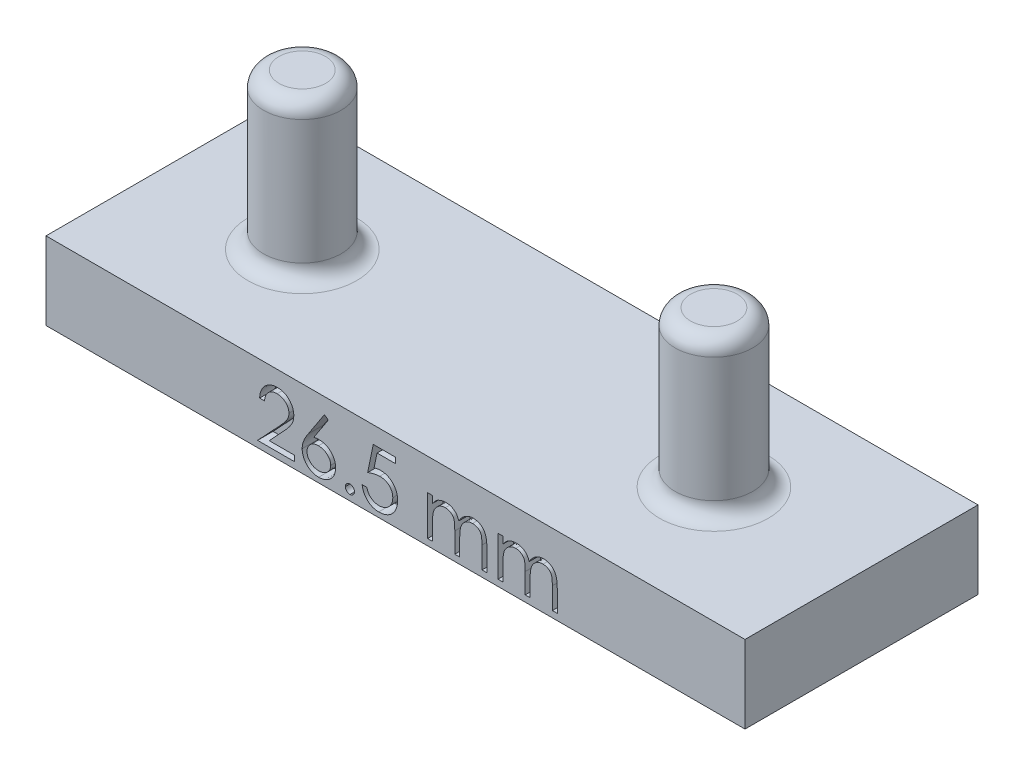
from build123d import *

# Parameters (mm, degrees)
SKETCH1_R             = 2.5
BOSS_EXTRUDE1_DEPTH   = 10
BOSS_EXTRUDE1_2_DEPTH = 10
SKETCH2_W             = 45
SKETCH2_H             = 15
BOSS_EXTRUDE2_DEPTH   = 5
CUT_EXTRUDE1_DEPTH    = 1
FILLET1_R             = 1


with BuildPart() as part:
    # Sketch1 → Boss-Extrude1 (new body)
    with BuildSketch(Plane(origin=(0, 0, 0), x_dir=(1, 0, 0), z_dir=(0, 1, 0))):
        with Locations((-41.821276596, 3.10212766)):
            Circle(SKETCH1_R)
    extrude(amount=BOSS_EXTRUDE1_DEPTH)



with BuildPart() as body_2:
    # Sketch1 → Boss-Extrude1 2 (new body)
    with BuildSketch(Plane(origin=(0, 0, 0), x_dir=(1, 0, 0), z_dir=(0, 1, 0))):
        with Locations((-15.321276596, 3.10212766)):
            Circle(SKETCH1_R)
    extrude(amount=BOSS_EXTRUDE1_2_DEPTH)


with BuildPart() as part_1:
    add(part.part)

    add(body_2.part)  # Boss-Extrude2 merges body 2
    # Sketch2 → Boss-Extrude2 (add)
    with BuildSketch(Plane.XZ):
        with Locations((-28.321276596, -3.10212766)):
            Rectangle(SKETCH2_W, SKETCH2_H)
    extrude(amount=BOSS_EXTRUDE2_DEPTH)

    # Sketch3 → Cut-Extrude1 (cut)
    # profile 1 of 6: a face of its own
    with BuildSketch(Plane.XY.offset(4.39787234)):
        with BuildLine():
            Line((-21.721415096, -2.034062219), (-21.407312532, -2.034062219))
            Line((-21.407312532, -2.034062219), (-21.407312532, -2.478573436))
            add(Edge.make_bspline(
                [(-21.407312532, -2.478573436), (-21.379028582, -2.439685835), (-21.324833822, -2.365173462), (-21.23596817, -2.266983177), (-21.147192057, -2.183655023), (-21.083258676, -2.139912151), (-21.052544904, -2.118897956)],
                knots=[0, 0, 0, 0, 1.134379233, 2.173579362, 3.122582517, 4, 4, 4, 4], degree=3))
            add(Edge.make_bspline(
                [(-21.052544904, -2.118897956), (-21.010680241, -2.09889259), (-20.927682342, -2.059231377), (-20.796263117, -2.018997818), (-20.661788447, -1.994272717), (-20.570980233, -1.990891343), (-20.525301314, -1.989190424)],
                knots=[0, 0, 0, 0, 1.014936303, 2.012140481, 3.000054389, 4, 4, 4, 4], degree=3))
            add(Edge.make_bspline(
                [(-20.525301314, -1.989190424), (-20.494408317, -1.990235714), (-20.433272738, -1.992304289), (-20.342688648, -2.005764324), (-20.254830036, -2.029030497), (-20.170216007, -2.061437821), (-20.090495328, -2.100684508), (-20.01740613, -2.146734216), (-19.951781922, -2.198431291), (-19.893655871, -2.258110224), (-19.841386845, -2.327446823), (-19.793307998, -2.408311072), (-19.748882786, -2.502518733), (-19.724261477, -2.570885274), (-19.71129891, -2.606878725)],
                knots=[0, 0, 0, 0, 1.009824226, 1.998387844, 2.986035974, 3.974953746, 4.955485308, 5.885931332, 6.793869504, 7.679848016, 8.601185859, 9.625726857, 10.749998409, 12, 12, 12, 12], degree=3))
            add(Edge.make_bspline(
                [(-19.71129891, -2.606878725), (-19.697587659, -2.582154306), (-19.670605842, -2.533500121), (-19.625300205, -2.464641858), (-19.577832408, -2.400235067), (-19.527797915, -2.340228642), (-19.475373328, -2.284918912), (-19.420311928, -2.23412301), (-19.362927146, -2.187622797), (-19.283134906, -2.133299637), (-19.179322299, -2.075598456), (-19.048434184, -2.025570012), (-18.912284013, -1.994653883), (-18.819866315, -1.99102361), (-18.773197949, -1.989190424)],
                knots=[0, 0, 0, 0, 0.86119277, 1.694706429, 2.50939023, 3.298075842, 4.073795165, 4.829715201, 5.57930267, 6.321991688, 7.768977793, 9.186738141, 10.579381044, 12, 12, 12, 12], degree=3))
            add(Edge.make_bspline(
                [(-18.773197949, -1.989190424), (-18.730316486, -1.990807645), (-18.646393299, -1.993972703), (-18.524216034, -2.018826176), (-18.410274228, -2.061503823), (-18.304797152, -2.11973746), (-18.209637339, -2.192916643), (-18.12692103, -2.279985481), (-18.057150666, -2.380328104), (-18.011572027, -2.474720092), (-17.980656762, -2.558055425), (-17.961595528, -2.629061717), (-17.944755833, -2.707213269), (-17.930774588, -2.792603531), (-17.920556036, -2.885534139), (-17.91298532, -2.985853015), (-17.907861247, -3.093638127), (-17.907499174, -3.168003627), (-17.907312532, -3.20633786)],
                knots=[0, 0, 0, 0, 1.209669288, 2.367440248, 3.500751976, 4.631527125, 5.755587489, 6.87532382, 8.007944318, 9.190864318, 9.82315674, 10.514484317, 11.263564316, 12.079023757, 12.955305781, 13.901327259, 14.918167583, 16, 16, 16, 16], degree=3))
            Line((-17.907312532, -3.20633786), (-17.907312532, -4.591754526))
            Line((-17.907312532, -4.591754526), (-18.221415096, -4.591754526))
            Line((-18.221415096, -4.591754526), (-18.221415096, -3.204935616))
            add(Edge.make_bspline(
                [(-18.221415096, -3.204935616), (-18.221492979, -3.172215042), (-18.221642658, -3.109331075), (-18.22433629, -3.019078624), (-18.229411604, -2.936810267), (-18.235346243, -2.862638179), (-18.243590052, -2.79638939), (-18.254235984, -2.738196972), (-18.265513664, -2.68760316), (-18.284249655, -2.631517113), (-18.314197546, -2.569646902), (-18.359815026, -2.502923326), (-18.417285133, -2.444842526), (-18.483645289, -2.394424209), (-18.559193734, -2.353430568), (-18.642458457, -2.324154558), (-18.732922509, -2.30603168), (-18.795545297, -2.304225665), (-18.827885449, -2.303292988)],
                knots=[0, 0, 0, 0, 1.253487763, 2.409012846, 3.458416907, 4.410876679, 5.259312806, 6.014470957, 6.676830364, 7.243083969, 8.276244668, 9.299465089, 10.325150304, 11.392391894, 12.482080715, 13.603491619, 14.762376348, 16, 16, 16, 16], degree=3))
            add(Edge.make_bspline(
                [(-18.827885449, -2.303292988), (-18.867555403, -2.304709145), (-18.945958314, -2.307508011), (-19.0604038, -2.336081884), (-19.170374817, -2.379162134), (-19.27258995, -2.441594591), (-19.36661774, -2.516402955), (-19.447517318, -2.605352551), (-19.514349504, -2.705982478), (-19.55960348, -2.79912918), (-19.588192781, -2.882798624), (-19.607069697, -2.955895996), (-19.621753088, -3.038977564), (-19.635523617, -3.131485055), (-19.644511345, -3.234055235), (-19.652679718, -3.346213636), (-19.656500581, -3.468297596), (-19.657035039, -3.552924284), (-19.657312532, -3.596862699)],
                knots=[0, 0, 0, 0, 1.090531906, 2.155305635, 3.229839962, 4.33261226, 5.44038871, 6.529323825, 7.629011124, 8.757537029, 9.370236727, 10.061839251, 10.834451254, 11.692844982, 12.636905849, 13.66920014, 14.789842145, 16, 16, 16, 16], degree=3))
            Line((-19.657312532, -3.596862699), (-19.657312532, -4.591754526))
            Line((-19.657312532, -4.591754526), (-19.971415096, -4.591754526))
            Line((-19.971415096, -4.591754526), (-19.971415096, -3.291173597))
            add(Edge.make_bspline(
                [(-19.971415096, -3.291173597), (-19.971494527, -3.254480278), (-19.971647344, -3.183886021), (-19.974323661, -3.082652345), (-19.979410283, -2.990571265), (-19.985290832, -2.907749802), (-19.99375101, -2.834338473), (-20.003360772, -2.769943715), (-20.014709383, -2.714726964), (-20.033499267, -2.654163579), (-20.062213736, -2.587442656), (-20.108401998, -2.516301635), (-20.166009578, -2.454033537), (-20.233580454, -2.400874789), (-20.309586136, -2.356933307), (-20.393569537, -2.325273556), (-20.48477445, -2.306849266), (-20.547652156, -2.304500769), (-20.579988814, -2.303292988)],
                knots=[0, 0, 0, 0, 1.320475261, 2.540461679, 3.643808994, 4.639130445, 5.527981419, 6.302341397, 6.981980563, 7.553956391, 8.582137848, 9.585246428, 10.591171744, 11.620968678, 12.668337649, 13.738356861, 14.836885341, 16, 16, 16, 16], degree=3))
            add(Edge.make_bspline(
                [(-20.579988814, -2.303292988), (-20.618005025, -2.304823448), (-20.693769985, -2.3078736), (-20.805071954, -2.335327874), (-20.912557638, -2.378331949), (-21.014512337, -2.437991768), (-21.108186485, -2.511890847), (-21.190194752, -2.598805742), (-21.259137278, -2.697654776), (-21.304869093, -2.789819292), (-21.334367567, -2.871392567), (-21.353962902, -2.940743515), (-21.370802527, -3.017743763), (-21.383316549, -3.102630874), (-21.395396965, -3.194851968), (-21.401227274, -3.294866458), (-21.406898836, -3.402588546), (-21.407171251, -3.476961091), (-21.407312532, -3.515532571)],
                knots=[0, 0, 0, 0, 1.098833095, 2.189935336, 3.297829714, 4.440610912, 5.596351641, 6.740013378, 7.886572111, 9.072425424, 9.705826452, 10.395263256, 11.156850408, 11.985370555, 12.878090359, 13.847760091, 14.883794034, 16, 16, 16, 16], degree=3))
            Line((-21.407312532, -3.515532571), (-21.407312532, -4.591754526))
            Line((-21.407312532, -4.591754526), (-21.721415096, -4.591754526))
            Line((-21.721415096, -4.591754526), (-21.721415096, -2.034062219))
        make_face()
    # profile 2 of 6: a face of its own
    with BuildSketch(Plane.XY.offset(4.39787234)):
        with BuildLine():
            Line((-26.253466378, -2.034062219), (-25.939363814, -2.034062219))
            Line((-25.939363814, -2.034062219), (-25.939363814, -2.478573436))
            add(Edge.make_bspline(
                [(-25.939363814, -2.478573436), (-25.911079864, -2.439685835), (-25.856885104, -2.365173462), (-25.768019452, -2.266983177), (-25.679243339, -2.183655023), (-25.615309958, -2.139912151), (-25.584596186, -2.118897956)],
                knots=[0, 0, 0, 0, 1.134379233, 2.173579362, 3.122582517, 4, 4, 4, 4], degree=3))
            add(Edge.make_bspline(
                [(-25.584596186, -2.118897956), (-25.542731524, -2.09889259), (-25.459733624, -2.059231377), (-25.328314399, -2.018997818), (-25.193839729, -1.994272717), (-25.103031515, -1.990891343), (-25.057352596, -1.989190424)],
                knots=[0, 0, 0, 0, 1.014936303, 2.012140481, 3.000054389, 4, 4, 4, 4], degree=3))
            add(Edge.make_bspline(
                [(-25.057352596, -1.989190424), (-25.026459599, -1.990235714), (-24.96532402, -1.992304289), (-24.87473993, -2.005764324), (-24.786881318, -2.029030497), (-24.702267289, -2.061437821), (-24.62254661, -2.100684508), (-24.549457412, -2.146734216), (-24.483833204, -2.198431291), (-24.425707153, -2.258110224), (-24.373438127, -2.327446823), (-24.325359281, -2.408311072), (-24.280934068, -2.502518733), (-24.256312759, -2.570885274), (-24.243350192, -2.606878725)],
                knots=[0, 0, 0, 0, 1.009824226, 1.998387844, 2.986035974, 3.974953746, 4.955485308, 5.885931332, 6.793869504, 7.679848016, 8.601185859, 9.625726857, 10.749998409, 12, 12, 12, 12], degree=3))
            add(Edge.make_bspline(
                [(-24.243350192, -2.606878725), (-24.229638941, -2.582154306), (-24.202657124, -2.533500121), (-24.157351487, -2.464641858), (-24.10988369, -2.400235067), (-24.059849197, -2.340228642), (-24.00742461, -2.284918912), (-23.95236321, -2.23412301), (-23.894978428, -2.187622797), (-23.815186189, -2.133299637), (-23.711373581, -2.075598456), (-23.580485466, -2.025570012), (-23.444335295, -1.994653883), (-23.351917597, -1.99102361), (-23.305249231, -1.989190424)],
                knots=[0, 0, 0, 0, 0.86119277, 1.694706429, 2.50939023, 3.298075842, 4.073795165, 4.829715201, 5.57930267, 6.321991688, 7.768977793, 9.186738141, 10.579381044, 12, 12, 12, 12], degree=3))
            add(Edge.make_bspline(
                [(-23.305249231, -1.989190424), (-23.262367768, -1.990807645), (-23.178444581, -1.993972703), (-23.056267316, -2.018826176), (-22.94232551, -2.061503823), (-22.836848434, -2.11973746), (-22.741688621, -2.192916643), (-22.658972312, -2.279985481), (-22.589201948, -2.380328104), (-22.543623309, -2.474720092), (-22.512708044, -2.558055425), (-22.49364681, -2.629061717), (-22.476807115, -2.707213269), (-22.46282587, -2.792603531), (-22.452607318, -2.885534139), (-22.445036602, -2.985853015), (-22.439912529, -3.093638127), (-22.439550456, -3.168003627), (-22.439363814, -3.20633786)],
                knots=[0, 0, 0, 0, 1.209669288, 2.367440248, 3.500751976, 4.631527125, 5.755587489, 6.87532382, 8.007944318, 9.190864318, 9.82315674, 10.514484317, 11.263564316, 12.079023757, 12.955305781, 13.901327259, 14.918167583, 16, 16, 16, 16], degree=3))
            Line((-22.439363814, -3.20633786), (-22.439363814, -4.591754526))
            Line((-22.439363814, -4.591754526), (-22.753466378, -4.591754526))
            Line((-22.753466378, -4.591754526), (-22.753466378, -3.204935616))
            add(Edge.make_bspline(
                [(-22.753466378, -3.204935616), (-22.753544261, -3.172215042), (-22.75369394, -3.109331075), (-22.756387572, -3.019078624), (-22.761462886, -2.936810267), (-22.767397525, -2.862638179), (-22.775641334, -2.79638939), (-22.786287266, -2.738196972), (-22.797564946, -2.68760316), (-22.816300937, -2.631517113), (-22.846248828, -2.569646902), (-22.891866308, -2.502923326), (-22.949336415, -2.444842526), (-23.015696571, -2.394424209), (-23.091245016, -2.353430568), (-23.174509739, -2.324154558), (-23.264973791, -2.30603168), (-23.327596579, -2.304225665), (-23.359936731, -2.303292988)],
                knots=[0, 0, 0, 0, 1.253487763, 2.409012846, 3.458416907, 4.410876679, 5.259312806, 6.014470957, 6.676830364, 7.243083969, 8.276244668, 9.299465089, 10.325150304, 11.392391894, 12.482080715, 13.603491619, 14.762376348, 16, 16, 16, 16], degree=3))
            add(Edge.make_bspline(
                [(-23.359936731, -2.303292988), (-23.399606685, -2.304709145), (-23.478009596, -2.307508011), (-23.592455082, -2.336081884), (-23.702426099, -2.379162134), (-23.804641232, -2.441594591), (-23.898669022, -2.516402955), (-23.9795686, -2.605352551), (-24.046400786, -2.705982478), (-24.091654762, -2.79912918), (-24.120244063, -2.882798624), (-24.139120979, -2.955895996), (-24.15380437, -3.038977564), (-24.1675749, -3.131485055), (-24.176562628, -3.234055235), (-24.184731, -3.346213636), (-24.188551863, -3.468297596), (-24.189086321, -3.552924284), (-24.189363814, -3.596862699)],
                knots=[0, 0, 0, 0, 1.090531906, 2.155305635, 3.229839962, 4.33261226, 5.44038871, 6.529323825, 7.629011124, 8.757537029, 9.370236727, 10.061839251, 10.834451254, 11.692844982, 12.636905849, 13.66920014, 14.789842145, 16, 16, 16, 16], degree=3))
            Line((-24.189363814, -3.596862699), (-24.189363814, -4.591754526))
            Line((-24.189363814, -4.591754526), (-24.503466378, -4.591754526))
            Line((-24.503466378, -4.591754526), (-24.503466378, -3.291173597))
            add(Edge.make_bspline(
                [(-24.503466378, -3.291173597), (-24.503545809, -3.254480278), (-24.503698626, -3.183886021), (-24.506374944, -3.082652345), (-24.511461565, -2.990571265), (-24.517342114, -2.907749802), (-24.525802292, -2.834338473), (-24.535412054, -2.769943715), (-24.546760665, -2.714726964), (-24.565550549, -2.654163579), (-24.594265018, -2.587442656), (-24.64045328, -2.516301635), (-24.69806086, -2.454033537), (-24.765631736, -2.400874789), (-24.841637418, -2.356933307), (-24.925620819, -2.325273556), (-25.016825732, -2.306849266), (-25.079703438, -2.304500769), (-25.112040096, -2.303292988)],
                knots=[0, 0, 0, 0, 1.320475261, 2.540461679, 3.643808994, 4.639130445, 5.527981419, 6.302341397, 6.981980563, 7.553956391, 8.582137848, 9.585246428, 10.591171744, 11.620968678, 12.668337649, 13.738356861, 14.836885341, 16, 16, 16, 16], degree=3))
            add(Edge.make_bspline(
                [(-25.112040096, -2.303292988), (-25.150056307, -2.304823448), (-25.225821267, -2.3078736), (-25.337123236, -2.335327874), (-25.44460892, -2.378331949), (-25.546563619, -2.437991768), (-25.640237767, -2.511890847), (-25.722246034, -2.598805742), (-25.79118856, -2.697654776), (-25.836920375, -2.789819292), (-25.866418849, -2.871392567), (-25.886014184, -2.940743515), (-25.90285381, -3.017743763), (-25.915367831, -3.102630874), (-25.927448247, -3.194851968), (-25.933278556, -3.294866458), (-25.938950118, -3.402588546), (-25.939222533, -3.476961091), (-25.939363814, -3.515532571)],
                knots=[0, 0, 0, 0, 1.098833095, 2.189935336, 3.297829714, 4.440610912, 5.596351641, 6.740013378, 7.886572111, 9.072425424, 9.705826452, 10.395263256, 11.156850408, 11.985370555, 12.878090359, 13.847760091, 14.883794034, 16, 16, 16, 16], degree=3))
            Line((-25.939363814, -3.515532571), (-25.939363814, -4.591754526))
            Line((-25.939363814, -4.591754526), (-26.253466378, -4.591754526))
            Line((-26.253466378, -4.591754526), (-26.253466378, -2.034062219))
        make_face()
    # profile 3 of 6: a face of its own
    with BuildSketch(Plane.XY.offset(4.39787234)):
        with BuildLine():
            Line((-28.317568942, -1.091754526), (-28.317568942, -1.450728885))
            Line((-28.317568942, -1.450728885), (-29.50807375, -1.450728885))
            Line((-29.50807375, -1.450728885), (-29.696675513, -2.371301802))
            add(Edge.make_bspline(
                [(-29.696675513, -2.371301802), (-29.659619638, -2.36107153), (-29.587829742, -2.341251996), (-29.481869881, -2.319246226), (-29.381277678, -2.305980782), (-29.316002308, -2.304169471), (-29.284415897, -2.303292988)],
                knots=[0, 0, 0, 0, 1.100273476, 2.13160584, 3.095893838, 4, 4, 4, 4], degree=3))
            add(Edge.make_bspline(
                [(-29.284415897, -2.303292988), (-29.245332158, -2.304138923), (-29.16848376, -2.305802244), (-29.056044813, -2.321774094), (-28.94871192, -2.346914008), (-28.84670955, -2.38203453), (-28.749848999, -2.426944263), (-28.659021438, -2.483044204), (-28.572863525, -2.548577535), (-28.492920931, -2.623922547), (-28.420396623, -2.706844164), (-28.356630633, -2.796002035), (-28.302468043, -2.890529697), (-28.258907288, -2.991330306), (-28.224122953, -3.097289459), (-28.200970959, -3.209522042), (-28.18555425, -3.326970162), (-28.183831863, -3.407274732), (-28.182953557, -3.448224879)],
                knots=[0, 0, 0, 0, 1.052922333, 2.070308379, 3.05430497, 4.020497103, 4.973039431, 5.925935799, 6.892292201, 7.88610001, 8.88166317, 9.857072816, 10.836096531, 11.812156883, 12.81219415, 13.836441305, 14.89672472, 16, 16, 16, 16], degree=3))
            add(Edge.make_bspline(
                [(-28.182953557, -3.448224879), (-28.183618633, -3.476747099), (-28.184939795, -3.533406087), (-28.191658383, -3.617550287), (-28.204594099, -3.69991312), (-28.221961823, -3.780505512), (-28.244504241, -3.859174885), (-28.271793295, -3.936146412), (-28.305189323, -4.010941019), (-28.341820698, -4.084266414), (-28.383067176, -4.154464921), (-28.428845683, -4.220113908), (-28.477211174, -4.282198189), (-28.52925256, -4.340051922), (-28.585453555, -4.39329494), (-28.645133522, -4.442243222), (-28.707816241, -4.487724552), (-28.774471483, -4.527892747), (-28.843613966, -4.564855703), (-28.916242183, -4.595179241), (-28.990702884, -4.622289769), (-29.068067759, -4.643899296), (-29.148161572, -4.660831851), (-29.231116347, -4.672332452), (-29.316497018, -4.680708889), (-29.37437203, -4.681233246), (-29.403606602, -4.681498116)],
                knots=[0, 0, 0, 0, 1.056347294, 2.098418968, 3.122841568, 4.141288669, 5.149314143, 6.15115421, 7.162517403, 8.180376062, 9.185164535, 10.17417709, 11.141909838, 12.097768115, 13.052685741, 14.0056014, 14.954263652, 15.917497458, 16.885230207, 17.854509472, 18.828990115, 19.81800267, 20.826176721, 21.857883937, 22.917946725, 24, 24, 24, 24], degree=3))
            add(Edge.make_bspline(
                [(-29.403606602, -4.681498116), (-29.438480783, -4.680807278), (-29.507091614, -4.679448136), (-29.607612181, -4.665229651), (-29.704326787, -4.644865734), (-29.796456888, -4.614229464), (-29.884828151, -4.57584217), (-29.968250869, -4.527325998), (-30.048856645, -4.472346894), (-30.123368682, -4.407466541), (-30.192524795, -4.336550859), (-30.254431304, -4.259593218), (-30.309564881, -4.177863776), (-30.357042628, -4.090965622), (-30.397540649, -3.999127091), (-30.429355638, -3.90200409), (-30.455033993, -3.800104086), (-30.465897413, -3.729950576), (-30.471415096, -3.694318629)],
                knots=[0, 0, 0, 0, 1.0467383, 2.05933395, 3.04377827, 4.011590433, 4.970194871, 5.932262533, 6.905835911, 7.896367577, 8.894135286, 9.877477877, 10.858688626, 11.851381753, 12.8477658, 13.868841284, 14.917554742, 16, 16, 16, 16], degree=3))
            Line((-30.471415096, -3.694318629), (-30.157312532, -3.694318629))
            add(Edge.make_bspline(
                [(-30.157312532, -3.694318629), (-30.149583974, -3.727695081), (-30.134729258, -3.791846476), (-30.102123509, -3.881977817), (-30.062257634, -3.962297041), (-30.014853285, -4.033866624), (-29.958303255, -4.096275622), (-29.893773826, -4.151892684), (-29.821426103, -4.202067813), (-29.741032873, -4.24389058), (-29.656219794, -4.279559334), (-29.567452584, -4.303311028), (-29.477148237, -4.320011921), (-29.416069867, -4.321683682), (-29.385377436, -4.322523757)],
                knots=[0, 0, 0, 0, 1.136247022, 2.183929868, 3.172523383, 4.106158343, 5.02341133, 5.958108904, 6.928429099, 7.938127109, 8.96079061, 9.975095812, 10.982467395, 12, 12, 12, 12], degree=3))
            add(Edge.make_bspline(
                [(-29.385377436, -4.322523757), (-29.355418991, -4.321702979), (-29.296430569, -4.320086861), (-29.209619182, -4.307647849), (-29.125806308, -4.288490277), (-29.045818951, -4.259820422), (-28.968257412, -4.224975704), (-28.895083641, -4.180260628), (-28.824180764, -4.12880061), (-28.757752631, -4.06984398), (-28.696913182, -4.004874285), (-28.64315706, -3.935396892), (-28.598380147, -3.861280045), (-28.560646038, -3.783806892), (-28.531992739, -3.702128335), (-28.511551758, -3.61662716), (-28.499548699, -3.52709218), (-28.497897519, -3.46602287), (-28.497056122, -3.434903565)],
                knots=[0, 0, 0, 0, 1.027316725, 2.022795036, 3.002884548, 3.971462791, 4.93288096, 5.914575861, 6.907176829, 7.935150275, 8.956128384, 9.956726525, 10.942570165, 11.921478529, 12.907843606, 13.90538589, 14.932640048, 16, 16, 16, 16], degree=3))
            add(Edge.make_bspline(
                [(-28.497056122, -3.434903565), (-28.497714601, -3.406827813), (-28.499003481, -3.351873524), (-28.509534051, -3.271474318), (-28.527851024, -3.195401275), (-28.553274904, -3.123287041), (-28.585554411, -3.055063599), (-28.625000724, -2.990660539), (-28.672354122, -2.930926706), (-28.72644601, -2.875834152), (-28.785704051, -2.824989277), (-28.851147794, -2.781645191), (-28.92140772, -2.745181273), (-28.99563732, -2.713713275), (-29.075602218, -2.691112529), (-29.159718851, -2.674144644), (-29.248895559, -2.664329281), (-29.309866247, -2.662967393), (-29.341206763, -2.662267347)],
                knots=[0, 0, 0, 0, 1.045622112, 2.046656509, 3.013763289, 3.955457236, 4.890082067, 5.820317437, 6.762574623, 7.722996705, 8.69280354, 9.665887285, 10.63943826, 11.638615906, 12.663482002, 13.728887084, 14.832589034, 16, 16, 16, 16], degree=3))
            add(Edge.make_bspline(
                [(-29.341206763, -2.662267347), (-29.368335691, -2.662847938), (-29.424350047, -2.664046711), (-29.510272873, -2.672873208), (-29.600564596, -2.687112503), (-29.694879092, -2.70669875), (-29.7934996, -2.732329827), (-29.896218001, -2.763044327), (-30.003250267, -2.799766326), (-30.075367992, -2.82749854), (-30.112440737, -2.841754526)],
                knots=[0, 0, 0, 0, 0.817624296, 1.688186739, 2.600797293, 3.572016777, 4.590301741, 5.671205678, 6.80286297, 8, 8, 8, 8], degree=3))
            Line((-30.112440737, -2.841754526), (-29.753466378, -1.091754526))
            Line((-29.753466378, -1.091754526), (-28.317568942, -1.091754526))
        make_face()
    # profile 4 of 6: a face of its own
    with BuildSketch(Plane.XY.offset(4.39787234)):
        with BuildLine():
            add(Edge.make_bspline(
                [(-31.256671506, -4.053292988), (-31.237181294, -4.054451154), (-31.198973012, -4.056721605), (-31.143733883, -4.072298279), (-31.093739224, -4.099956939), (-31.049206979, -4.136819717), (-31.012500502, -4.181515381), (-30.98385615, -4.231111289), (-30.968415165, -4.286812882), (-30.966161253, -4.325242557), (-30.96500484, -4.344959654)],
                knots=[0, 0, 0, 0, 1.020151414, 1.999887582, 2.974338812, 3.990962822, 5.007586832, 5.987933904, 6.967670073, 8, 8, 8, 8], degree=3))
            add(Edge.make_bspline(
                [(-30.96500484, -4.344959654), (-30.96620044, -4.364202984), (-30.968558147, -4.402150548), (-30.983820756, -4.457432011), (-31.012718806, -4.507058915), (-31.048953799, -4.552361053), (-31.093750232, -4.589301924), (-31.143852079, -4.616725268), (-31.198843337, -4.633417248), (-31.23715966, -4.635543545), (-31.256671506, -4.636626321)],
                knots=[0, 0, 0, 0, 1.009421747, 1.99056486, 2.972319754, 3.999869655, 5.017953583, 5.993804169, 6.978383603, 8, 8, 8, 8], degree=3))
            add(Edge.make_bspline(
                [(-31.256671506, -4.636626321), (-31.276197412, -4.635582724), (-31.314317094, -4.633545349), (-31.369103089, -4.616382543), (-31.419510057, -4.589559082), (-31.464297769, -4.552292173), (-31.500836241, -4.507292029), (-31.528461623, -4.457090233), (-31.545051772, -4.402308796), (-31.547233645, -4.364234153), (-31.548338173, -4.344959654)],
                knots=[0, 0, 0, 0, 1.022052826, 1.995314843, 2.982371812, 4.00089066, 5.028879526, 6.005146991, 6.990147033, 8, 8, 8, 8], degree=3))
            add(Edge.make_bspline(
                [(-31.548338173, -4.344959654), (-31.547276074, -4.325210275), (-31.545202455, -4.286652035), (-31.528426795, -4.231452927), (-31.501050583, -4.181284488), (-31.464045188, -4.136887908), (-31.419520892, -4.099700605), (-31.369224687, -4.072635812), (-31.314185147, -4.0565954), (-31.276175208, -4.054412883), (-31.256671506, -4.053292988)],
                knots=[0, 0, 0, 0, 1.032775665, 2.016367738, 2.991239715, 4.008302682, 5.025365648, 6.011011707, 6.979408107, 8, 8, 8, 8], degree=3))
        make_face()
    # profile 5 of 6: a face of its own
    with BuildSketch(Plane.XY.offset(4.39787234)):
        with BuildLine():
            Line((-32.894492019, -1.002010936), (-32.652605, -1.192014943))
            Line((-32.652605, -1.192014943), (-33.577384647, -2.606177603))
            add(Edge.make_bspline(
                [(-33.577384647, -2.606177603), (-33.51581437, -2.596363743), (-33.395714583, -2.577220698), (-33.274148685, -2.574062752), (-33.214904679, -2.572523757)],
                knots=[0, 0, 0, 0, 1.025318673, 2, 2, 2, 2], degree=3))
            add(Edge.make_bspline(
                [(-33.214904679, -2.572523757), (-33.179332183, -2.573479869), (-33.109308782, -2.575361946), (-33.00650198, -2.589845797), (-32.907713044, -2.612670909), (-32.813351432, -2.645943165), (-32.72307845, -2.688445519), (-32.636376054, -2.739384389), (-32.554874044, -2.80139007), (-32.477522865, -2.870655025), (-32.407295767, -2.94737201), (-32.345119712, -3.028773347), (-32.29289292, -3.114774228), (-32.250518999, -3.205331094), (-32.21761412, -3.300304353), (-32.193626475, -3.399572493), (-32.179446882, -3.503203964), (-32.177521391, -3.573682139), (-32.176543301, -3.609482892)],
                knots=[0, 0, 0, 0, 1.04369286, 2.054478336, 3.041073146, 4.015093852, 4.984733326, 5.965804835, 6.960378782, 7.985147595, 9.009457201, 10.008161701, 10.986880575, 11.956520048, 12.937015923, 13.931873656, 14.949455224, 16, 16, 16, 16], degree=3))
            add(Edge.make_bspline(
                [(-32.176543301, -3.609482892), (-32.177966406, -3.658462596), (-32.18076674, -3.754843062), (-32.208670536, -3.895219768), (-32.25203018, -4.028952283), (-32.314007709, -4.153905455), (-32.390990092, -4.269908024), (-32.484867684, -4.37269349), (-32.592311173, -4.464363527), (-32.713797971, -4.541020146), (-32.844540935, -4.603623197), (-32.981892932, -4.648588439), (-33.124520079, -4.676271909), (-33.221324687, -4.679742512), (-33.270293301, -4.681498116)],
                knots=[0, 0, 0, 0, 1.031375318, 2.029502543, 3.004789286, 3.987476834, 4.960371455, 5.9300674, 6.912260825, 7.929083631, 8.949397511, 9.960523116, 10.96833055, 12, 12, 12, 12], degree=3))
            add(Edge.make_bspline(
                [(-33.270293301, -4.681498116), (-33.317390002, -4.67996991), (-33.41068032, -4.676942802), (-33.547913114, -4.649976864), (-33.679776131, -4.606269762), (-33.805345512, -4.546055483), (-33.921666125, -4.4699976), (-34.025731762, -4.378435321), (-34.117023536, -4.273325856), (-34.192998157, -4.154685509), (-34.253256889, -4.027195551), (-34.298446814, -3.894258395), (-34.324843057, -3.756358413), (-34.328531614, -3.662877274), (-34.330389455, -3.615792988)],
                knots=[0, 0, 0, 0, 1.012016664, 2.004627821, 2.994792927, 3.992885782, 4.990978636, 5.973936114, 6.964471063, 7.975201453, 8.993600317, 9.990122807, 10.98767138, 12, 12, 12, 12], degree=3))
            add(Edge.make_bspline(
                [(-34.330389455, -3.615792988), (-34.32920801, -3.579748405), (-34.326795725, -3.506152253), (-34.309952335, -3.394688225), (-34.28288754, -3.280637143), (-34.252577293, -3.183882949), (-34.220551683, -3.104621427), (-34.193899144, -3.040717937), (-34.160725148, -2.974956863), (-34.125351767, -2.905083228), (-34.084594898, -2.832897795), (-34.040279248, -2.757194125), (-33.991179597, -2.679176198), (-33.956759435, -2.626232002), (-33.939163493, -2.599166385)],
                knots=[0, 0, 0, 0, 1.173818275, 2.396712641, 3.66331629, 4.989737886, 5.693666774, 6.447286557, 7.243889047, 8.091586357, 8.998013824, 9.943181721, 10.948533338, 12, 12, 12, 12], degree=3))
            Line((-33.939163493, -2.599166385), (-32.894492019, -1.002010936))
        make_face()
        with BuildLine():
            add(Edge.make_bspline(
                [(-33.280810128, -2.931498116), (-33.307472373, -2.93227616), (-33.359551482, -2.933795905), (-33.435958897, -2.942621157), (-33.508272148, -2.959240222), (-33.577449282, -2.980406554), (-33.642196985, -3.009509614), (-33.702985825, -3.044861413), (-33.760050877, -3.086482591), (-33.812794428, -3.133783502), (-33.860614092, -3.185571535), (-33.901795223, -3.241041058), (-33.937317623, -3.298855261), (-33.966199442, -3.359497203), (-33.988689517, -3.422943702), (-34.004957768, -3.488902952), (-34.014011519, -3.557817258), (-34.015517751, -3.604549761), (-34.016286891, -3.62841318)],
                knots=[0, 0, 0, 0, 1.129588631, 2.206414736, 3.251139165, 4.268635594, 5.265702196, 6.250456724, 7.242448911, 8.251968645, 9.246821453, 10.222880186, 11.173611482, 12.116736599, 13.062300278, 14.020270554, 14.989073742, 16, 16, 16, 16], degree=3))
            add(Edge.make_bspline(
                [(-34.016286891, -3.62841318), (-34.015660529, -3.65206316), (-34.014432328, -3.69843725), (-34.003280008, -3.766776429), (-33.986244926, -3.832541338), (-33.96090453, -3.895392936), (-33.930677642, -3.956289254), (-33.890772317, -4.01302454), (-33.846555531, -4.06904461), (-33.793701598, -4.120046081), (-33.736978235, -4.167502706), (-33.676377033, -4.208982959), (-33.613217073, -4.244469133), (-33.546645651, -4.27228023), (-33.477607267, -4.295104517), (-33.405526713, -4.311165996), (-33.330353857, -4.320246522), (-33.279431919, -4.321754716), (-33.253466378, -4.322523757)],
                knots=[0, 0, 0, 0, 0.989467248, 1.94019797, 2.891935182, 3.827694429, 4.772920941, 5.730924762, 6.725747692, 7.756678648, 8.79901574, 9.819492441, 10.826891316, 11.826466727, 12.835195252, 13.867842842, 14.912794438, 16, 16, 16, 16], degree=3))
            add(Edge.make_bspline(
                [(-33.253466378, -4.322523757), (-33.227500879, -4.321754656), (-33.176579025, -4.320246344), (-33.101405565, -4.311166675), (-33.029327246, -4.295102027), (-32.960280737, -4.272289257), (-32.893739306, -4.244435647), (-32.830634585, -4.209203727), (-32.770606491, -4.16724761), (-32.713845892, -4.120127181), (-32.661211953, -4.068754329), (-32.615934675, -4.013524607), (-32.577251441, -3.955830712), (-32.545817254, -3.895632822), (-32.520755963, -3.832503334), (-32.503634496, -3.76678661), (-32.492505207, -3.698434584), (-32.491273841, -3.65206226), (-32.490645865, -3.62841318)],
                knots=[0, 0, 0, 0, 1.087397944, 2.132534446, 3.165364764, 4.174271784, 5.174024072, 6.181601208, 7.194203697, 8.236725232, 9.267838612, 10.269026844, 11.221737037, 12.171628256, 13.107553087, 14.05945871, 15.010357665, 16, 16, 16, 16], degree=3))
            add(Edge.make_bspline(
                [(-32.490645865, -3.62841318), (-32.491196158, -3.604518629), (-32.492276204, -3.557621397), (-32.504492153, -3.488933778), (-32.521434527, -3.422608572), (-32.547017558, -3.359062623), (-32.580254102, -3.298546696), (-32.620737509, -3.240755095), (-32.66757008, -3.185244748), (-32.721667619, -3.133681939), (-32.780557853, -3.086534861), (-32.843173439, -3.044915305), (-32.908681412, -3.009790328), (-32.977015355, -2.980483226), (-33.048958237, -2.959333752), (-33.123348576, -2.942680509), (-33.201137819, -2.933818491), (-33.253914427, -2.932281426), (-33.280810128, -2.931498116)],
                knots=[0, 0, 0, 0, 0.978206639, 1.919901502, 2.851605144, 3.780102724, 4.718870031, 5.675451981, 6.667674623, 7.690630536, 8.733308323, 9.756129687, 10.767539656, 11.776269907, 12.797430371, 13.836405707, 14.897401972, 16, 16, 16, 16], degree=3))
        make_face(mode=Mode.SUBTRACT)
    # profile 6 of 6: a face of its own
    with BuildSketch(Plane.XY.offset(4.39787234)):
        with BuildLine():
            Line((-36.753466378, -2.168677603), (-37.067568942, -2.168677603))
            add(Edge.make_bspline(
                [(-37.067568942, -2.168677603), (-37.065521789, -2.127006715), (-37.061501235, -2.045166201), (-37.042672946, -1.925842294), (-37.015732069, -1.811787496), (-36.977640615, -1.703917582), (-36.930334337, -1.601278774), (-36.873604309, -1.504278759), (-36.806410459, -1.41328757), (-36.730203725, -1.329148727), (-36.647435086, -1.251961156), (-36.558129146, -1.185305913), (-36.464284119, -1.128988242), (-36.36618472, -1.081907), (-36.262724157, -1.046567154), (-36.154841299, -1.020345514), (-36.042062162, -1.004569169), (-35.96522214, -1.002873383), (-35.92614266, -1.002010936)],
                knots=[0, 0, 0, 0, 1.10065271, 2.161652631, 3.183658789, 4.190468796, 5.17591951, 6.163126047, 7.15150782, 8.156236427, 9.156009102, 10.134482811, 11.092018607, 12.041330605, 13.001268258, 13.972401359, 14.968799086, 16, 16, 16, 16], degree=3))
            add(Edge.make_bspline(
                [(-35.92614266, -1.002010936), (-35.887764586, -1.002909393), (-35.812353041, -1.004674828), (-35.702291027, -1.019835857), (-35.597513732, -1.043581449), (-35.498225966, -1.076896865), (-35.405219901, -1.121681292), (-35.317796857, -1.175478831), (-35.234916046, -1.237698662), (-35.160309262, -1.310952476), (-35.091801183, -1.38915486), (-35.032698928, -1.472642764), (-34.982085764, -1.55887205), (-34.939898085, -1.648500251), (-34.908841946, -1.74237128), (-34.885263738, -1.839118482), (-34.871936324, -1.939743293), (-34.8698909, -2.007849849), (-34.868850993, -2.04247568)],
                knots=[0, 0, 0, 0, 1.111607364, 2.184268762, 3.212621178, 4.221274766, 5.211760367, 6.196651075, 7.1921475, 8.207485113, 9.220403448, 10.201281604, 11.166441695, 12.114753415, 13.065576456, 14.026450734, 14.996634279, 16, 16, 16, 16], degree=3))
            add(Edge.make_bspline(
                [(-34.868850993, -2.04247568), (-34.870544256, -2.091223515), (-34.873901068, -2.187863728), (-34.902615444, -2.329878591), (-34.947461955, -2.46747201), (-35.001459312, -2.578209312), (-35.055931756, -2.667442806), (-35.105019264, -2.740911511), (-35.162484075, -2.820016979), (-35.229162573, -2.904494317), (-35.303675445, -2.995005222), (-35.386697608, -3.091495017), (-35.47882109, -3.192966787), (-35.543479591, -3.262272388), (-35.576984006, -3.298184815)],
                knots=[0, 0, 0, 0, 1.184426356, 2.348067706, 3.509069118, 4.696110526, 5.333549288, 6.050745305, 6.844228056, 7.710549037, 8.667450064, 9.695053472, 10.805634456, 12, 12, 12, 12], degree=3))
            Line((-35.576984006, -3.298184815), (-36.452685128, -4.232780167))
            Line((-36.452685128, -4.232780167), (-34.823979199, -4.232780167))
            Line((-34.823979199, -4.232780167), (-34.823979199, -4.591754526))
            Line((-34.823979199, -4.591754526), (-37.202184327, -4.591754526))
            Line((-37.202184327, -4.591754526), (-35.844812532, -3.143236898))
            add(Edge.make_bspline(
                [(-35.844812532, -3.143236898), (-35.811764645, -3.108738591), (-35.748286418, -3.042474405), (-35.658503841, -2.945731445), (-35.577864853, -2.855981904), (-35.50584746, -2.773395356), (-35.444013955, -2.696763788), (-35.389141723, -2.628569084), (-35.345176132, -2.565814634), (-35.297460736, -2.49307402), (-35.251246755, -2.404261703), (-35.211534399, -2.295728014), (-35.18731955, -2.184000761), (-35.184414715, -2.108498724), (-35.182953557, -2.070520552)],
                knots=[0, 0, 0, 0, 1.329631726, 2.553950428, 3.673215718, 4.687767853, 5.603093632, 6.413772471, 7.123043292, 7.734684054, 8.834405432, 9.900288307, 10.943827018, 12, 12, 12, 12], degree=3))
            add(Edge.make_bspline(
                [(-35.182953557, -2.070520552), (-35.1835893, -2.046639153), (-35.184842226, -1.999573503), (-35.195899923, -1.930567744), (-35.212610429, -1.86400293), (-35.236555687, -1.799674311), (-35.268162428, -1.738228659), (-35.306635807, -1.679591179), (-35.351025871, -1.622902214), (-35.40237714, -1.569748916), (-35.45878866, -1.52106771), (-35.51838291, -1.477943625), (-35.581433014, -1.441904514), (-35.647673136, -1.412361017), (-35.716918605, -1.389185636), (-35.789303351, -1.373127056), (-35.864627367, -1.363044572), (-35.916060862, -1.3616804), (-35.942268461, -1.360985295)],
                knots=[0, 0, 0, 0, 0.991446411, 1.95395049, 2.89581595, 3.838931463, 4.798493298, 5.75982156, 6.748411868, 7.785213223, 8.824556874, 9.840280684, 10.836137867, 11.835679398, 12.848801643, 13.863922112, 14.911575587, 16, 16, 16, 16], degree=3))
            add(Edge.make_bspline(
                [(-35.942268461, -1.360985295), (-35.969639294, -1.361700328), (-36.02339109, -1.363104533), (-36.102310123, -1.372927197), (-36.177595901, -1.389873037), (-36.249437804, -1.413049712), (-36.31795739, -1.442508261), (-36.382821434, -1.479200005), (-36.443884323, -1.522983498), (-36.501260846, -1.572624055), (-36.554124825, -1.627891656), (-36.600571701, -1.689501619), (-36.641155715, -1.756329034), (-36.676564949, -1.828193585), (-36.705320639, -1.905747365), (-36.727293789, -1.98871507), (-36.744680636, -2.076736451), (-36.750489157, -2.137521536), (-36.753466378, -2.168677603)],
                knots=[0, 0, 0, 0, 1.031018746, 2.02475058, 2.990194455, 3.934040569, 4.864654155, 5.795059489, 6.735614925, 7.690564532, 8.649604399, 9.611025574, 10.590972636, 11.591080095, 12.624614302, 13.701020113, 14.821632451, 16, 16, 16, 16], degree=3))
        make_face()
    extrude(amount=-CUT_EXTRUDE1_DEPTH, mode=Mode.SUBTRACT)

    # Fillet1
    fillet1_edges = [part_1.edges().sort_by_distance(p)[0] for p in [
        (-44.321276596, 0, -3.10212766),
        (-17.821276596, 0, -3.10212766),
        (-17.821276596, 10, -3.10212766),
        (-44.321276596, 10, -3.10212766),
    ]]
    fillet(fillet1_edges, radius=FILLET1_R)


solid = part_1.part
